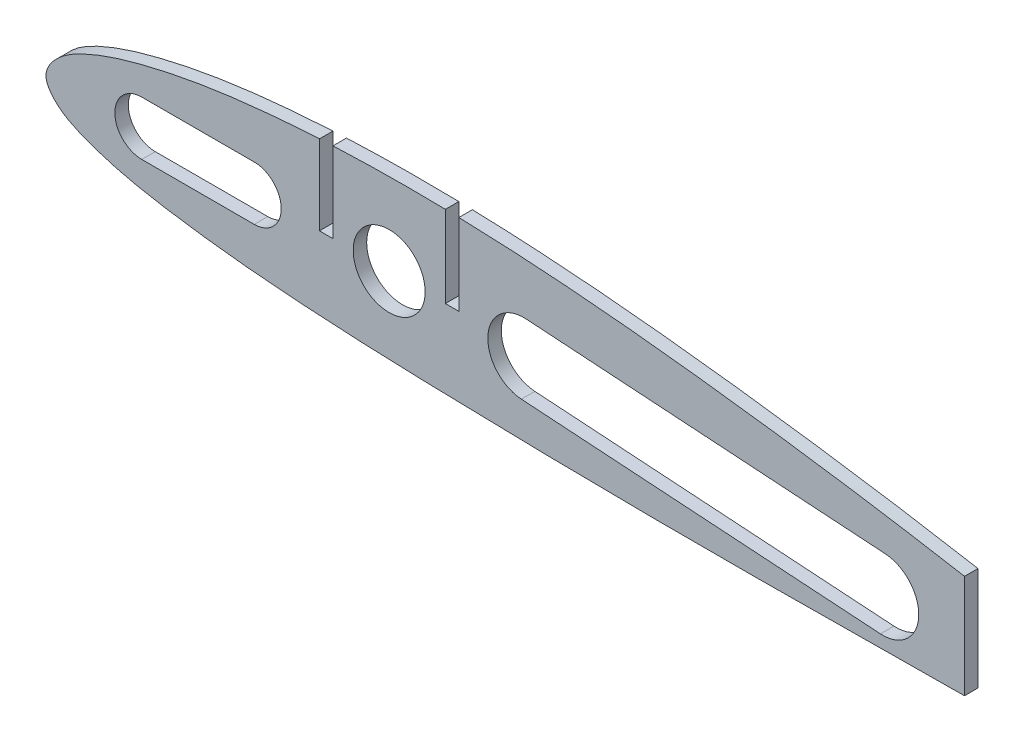
from build123d import *

# Parameters (mm, degrees)
STOCK_WING_STRUCTURESIZING_1_START = 350.5
STOCK_WING_STRUCTURESIZING_1_DEPTH = 3
CUT_EXTRUDE2_DEPTH                 = 278.894871602
CUT_EXTRUDE2_DEPTH_BACK            = 278.894871602
SKETCH3_R                          = 8
SKETCH3_W                          = 3
SKETCH3_H                          = 18.234468085
CUT_EXTRUDE4_DEPTH                 = 278.894871602
CUT_EXTRUDE4_DEPTH_BACK            = 278.894871602
CUT_EXTRUDE5_DEPTH                 = 278.894871602
CUT_EXTRUDE5_DEPTH_BACK            = 278.894871602
SKETCH6_W                          = 72
SKETCH6_H                          = 36.832163157


# Read off the part's stored shape, not the designer's step: Stock-Wing_structureSizing-1
with BuildPart() as part:
    # Stock-Wing_structureSizing-1 outline → Stock-Wing_structureSizing-1 (new body)
    with BuildSketch(Plane.XY.offset(STOCK_WING_STRUCTURESIZING_1_START)):
        with BuildLine():
            Line((276.744987748, -9.975467242), (276.744987748, -2.791972149))
            add(Edge.make_bspline(
                [(276.744987748, -2.791972149), (265.3857023, -0.102525952), (253.985388892, 2.407220527), (231.123115134, 7.137179769), (219.66894224, 9.35664169), (202.450532833, 12.449607831), (196.704666185, 13.440005467), (185.197495984, 15.322846112), (179.436018194, 16.214183509), (167.896810084, 17.893728146), (162.119320772, 18.683464695), (150.549559093, 20.169132171), (144.757676972, 20.867539393), (133.154760401, 22.142823058), (127.340720117, 22.719276226), (115.726117513, 23.709424358), (109.921864102, 24.123286294), (92.520744809, 25.054695045), (80.935765142, 25.255529424), (63.589579679, 24.723206588), (57.812696472, 24.40777964), (49.15741104, 23.667136334), (46.27396258, 23.376378774), (40.511150261, 22.68602794), (37.631848569, 22.284778258), (31.878918329, 21.331115885), (29.005409213, 20.775520933), (24.699904445, 19.815325722), (23.265457389, 19.476044022), (20.398415094, 18.74813831), (18.963740816, 18.357002163), (16.106748162, 17.497000764), (14.692710081, 17.03099603), (11.902486035, 16.004726933), (10.526189891, 15.444736939), (8.50012674, 14.509175123), (7.830361802, 14.183402304), (6.512563898, 13.477739544), (5.865248411, 13.093583044), (4.633392785, 12.255605476), (4.045066641, 11.801499914), (3.209118512, 11.061128735), (2.938431583, 10.804207958), (2.416562808, 10.265550671), (2.165207772, 9.983507914), (1.696102707, 9.397220013), (1.477442994, 9.09171798), (1.085439515, 8.447078561), (0.915512906, 8.113897404), (0.714798114, 7.59155933), (0.657190766, 7.413573783), (0.566275814, 7.047480769), (0.533643429, 6.859526942), (0.498702003, 6.485823786), (0.495732967, 6.298500114), (0.52230969, 5.922794269), (0.553180601, 5.733657444), (0.641956646, 5.367254731), (0.699629973, 5.188174612), (0.835770495, 4.836464845), (0.914681224, 4.663114785), (1.173802922, 4.160517642), (1.376431151, 3.845824341), (1.822835658, 3.244491079), (2.068245893, 2.956719217), (2.585349641, 2.410512622), (2.856205808, 2.152934366), (3.699269455, 1.418677094), (4.302923323, 0.981675809), (5.262649419, 0.394618321), (5.591648375, 0.21018796), (6.254696782, -0.135942129), (6.589931521, -0.298692503), (7.602521133, -0.767803382), (8.28593821, -1.057311971), (9.662885491, -1.60821635), (10.357226689, -1.867357708), (12.455074514, -2.603572901), (13.873250521, -3.039868309), (16.739197416, -3.830190303), (18.188973825, -4.184254143), (22.54237297, -5.143962802), (25.459339583, -5.655261329), (31.306270814, -6.564233952), (34.235701619, -6.966574468), (40.104165427, -7.687316125), (43.043386977, -8.004069053), (51.874086741, -8.840379009), (57.778366073, -9.248032718), (66.64804678, -9.743583642), (69.60756187, -9.887823594), (75.525585547, -10.141245843), (78.484610817, -10.250077692), (84.402679828, -10.443151081), (87.361723417, -10.527595381), (93.279819329, -10.684856962), (96.238871496, -10.7578835), (111.034153794, -11.094438823), (122.870449548, -11.270610432), (140.625005024, -11.385979432), (146.54320834, -11.400264082), (158.379650661, -11.381324799), (164.297889136, -11.348805922), (176.134384089, -11.259801078), (182.052639742, -11.204415721), (193.889154401, -11.089178887), (199.807414258, -11.02819544), (217.562198328, -10.839257795), (229.398721047, -10.713290888), (253.0718283, -10.379069852), (264.908412973, -10.164021277), (276.744987748, -9.975467242)],
                knots=[0, 0, 0, 0, 0.0625, 0.0625, 0.125, 0.125, 0.15625, 0.15625, 0.1875, 0.1875, 0.21875, 0.21875, 0.25, 0.25, 0.28125, 0.28125, 0.3125, 0.3125, 0.375, 0.375, 0.40625, 0.40625, 0.421875, 0.421875, 0.4375, 0.4375, 0.453125, 0.453125, 0.4609375, 0.4609375, 0.46875, 0.46875, 0.4765625, 0.4765625, 0.484375, 0.484375, 0.48828125, 0.48828125, 0.4921875, 0.4921875, 0.49609375, 0.49609375, 0.498046875, 0.498046875, 0.5, 0.5, 0.501953125, 0.501953125, 0.50390625, 0.50390625, 0.504882813, 0.504882813, 0.505859375, 0.505859375, 0.506835938, 0.506835938, 0.5078125, 0.5078125, 0.508789063, 0.508789063, 0.509765625, 0.509765625, 0.51171875, 0.51171875, 0.513671875, 0.513671875, 0.515625, 0.515625, 0.51953125, 0.51953125, 0.521484375, 0.521484375, 0.5234375, 0.5234375, 0.52734375, 0.52734375, 0.53125, 0.53125, 0.5390625, 0.5390625, 0.546875, 0.546875, 0.5625, 0.5625, 0.578125, 0.578125, 0.59375, 0.59375, 0.625, 0.625, 0.640625, 0.640625, 0.65625, 0.65625, 0.671875, 0.671875, 0.6875, 0.6875, 0.75, 0.75, 0.78125, 0.78125, 0.8125, 0.8125, 0.84375, 0.84375, 0.875, 0.875, 0.9375, 0.9375, 1, 1, 1, 1], degree=3))
        make_face()
    extrude(amount=STOCK_WING_STRUCTURESIZING_1_DEPTH)

    # Sketch3 → Cut-Extrude2 (cut, two sides: drawn at the far end of the back side and taken through both)
    with BuildSketch(Plane.XY.offset(353.5).offset(-CUT_EXTRUDE2_DEPTH_BACK)):
        with Locations((76.810751166, 6.840845639)):
            Circle(SKETCH3_R)
        with Locations((62.810751166, 15.958079682)):
            Rectangle(SKETCH3_W, SKETCH3_H)
        with Locations((90.810751166, 15.958079682)):
            Rectangle(SKETCH3_W, SKETCH3_H)
    extrude(amount=CUT_EXTRUDE2_DEPTH + CUT_EXTRUDE2_DEPTH_BACK, mode=Mode.SUBTRACT)

    # Sketch5 → Cut-Extrude4 (cut, two sides: drawn at the far end of the back side and taken through both)
    with BuildSketch(Plane.XY.offset(353.5).offset(-CUT_EXTRUDE4_DEPTH_BACK)):
        with BuildLine():
            Line((107.273341988, 12.843391801), (187.098909951, 7.563363443))
            ThreePointArc((187.098909951, 7.563363443), (194.553463911, -0.947196189), (186.042904279, -8.401750149))
            Line((186.042904279, -8.401750149), (106.217336316, -3.121721792))
            ThreePointArc((106.217336316, -3.121721792), (98.762782356, 5.388837841), (107.273341988, 12.843391801))
        make_face()
        with BuildLine():
            Line((46.810751166, 0.840845639), (21.810751166, 0.840845639))
            ThreePointArc((21.810751166, 0.840845639), (15.810751166, 6.840845639), (21.810751166, 12.840845639))
            Line((21.810751166, 12.840845639), (46.810751166, 12.840845639))
            ThreePointArc((46.810751166, 12.840845639), (52.810751166, 6.840845639), (46.810751166, 0.840845639))
        make_face()
    extrude(amount=CUT_EXTRUDE4_DEPTH + CUT_EXTRUDE4_DEPTH_BACK, mode=Mode.SUBTRACT)

    # Sketch6 → Cut-Extrude5 (cut, two sides: drawn at the far end of the back side and taken through both)
    with BuildSketch(Plane.XY.offset(353.5).offset(-CUT_EXTRUDE5_DEPTH_BACK)):
        with Locations((240.744987748, -6.383719695)):
            Rectangle(SKETCH6_W, SKETCH6_H)
    extrude(amount=CUT_EXTRUDE5_DEPTH + CUT_EXTRUDE5_DEPTH_BACK, mode=Mode.SUBTRACT)


solid = part.part
